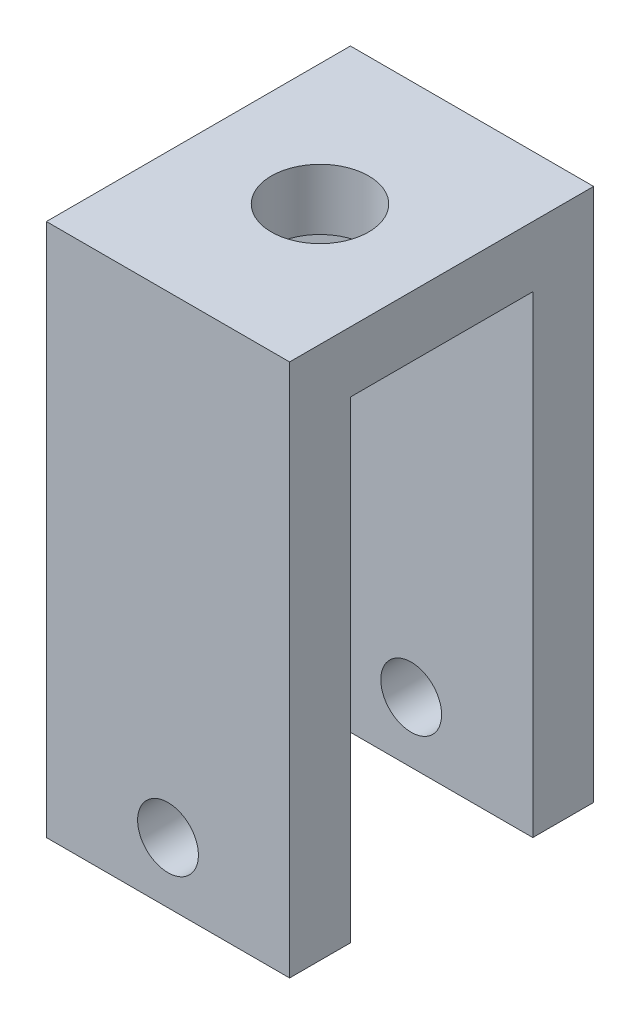
from build123d import *

# Parameters (mm, degrees)
ESQUISSE1_W             = 8
ESQUISSE1_H             = 17.55
BOSS_EXTRU_1_DEPTH      = 10
ESQUISSE2_W             = 6
ESQUISSE2_H             = 15.55
ENL_V_MAT_EXTRU_1_DEPTH = 22.725618518
ESQUISSE3_R             = 1
ENL_V_MAT_EXTRU_2_DEPTH = 21.591320987
ESQUISSE5_R             = 1.6
ENL_V_MAT_EXTRU_3_DEPTH = 19.915668109


with BuildPart() as part:
    # Esquisse1 → Boss.-Extru.1 (new body)
    with BuildSketch(Plane.XY):
        with Locations((0, 8.775)):
            Rectangle(ESQUISSE1_W, ESQUISSE1_H)
    extrude(amount=BOSS_EXTRU_1_DEPTH)

    # Esquisse2 → Enlèv. mat.-Extru.1 (cut, through all)
    with BuildSketch(Plane(origin=(4, 0, 0), x_dir=(0, 0, -1), z_dir=(1, 0, 0))):
        with Locations((-5, 7.775)):
            Rectangle(ESQUISSE2_W, ESQUISSE2_H)
    extrude(amount=-ENL_V_MAT_EXTRU_1_DEPTH, mode=Mode.SUBTRACT)

    # Esquisse3 → Enlèv. mat.-Extru.2 (cut, through all)
    with BuildSketch(Plane(origin=(0, 0, 0), x_dir=(-1, 0, 0), z_dir=(0, 0, -1))):
        with Locations((0, 2)):
            Circle(ESQUISSE3_R)
    extrude(amount=-ENL_V_MAT_EXTRU_2_DEPTH, mode=Mode.SUBTRACT)

    # Esquisse5 → Enlèv. mat.-Extru.3 (cut, through all)
    with BuildSketch(Plane.XZ.offset(-15.55)):
        with Locations((0, 5)):
            Circle(ESQUISSE5_R)
    extrude(amount=-ENL_V_MAT_EXTRU_3_DEPTH, mode=Mode.SUBTRACT)


solid = part.part
